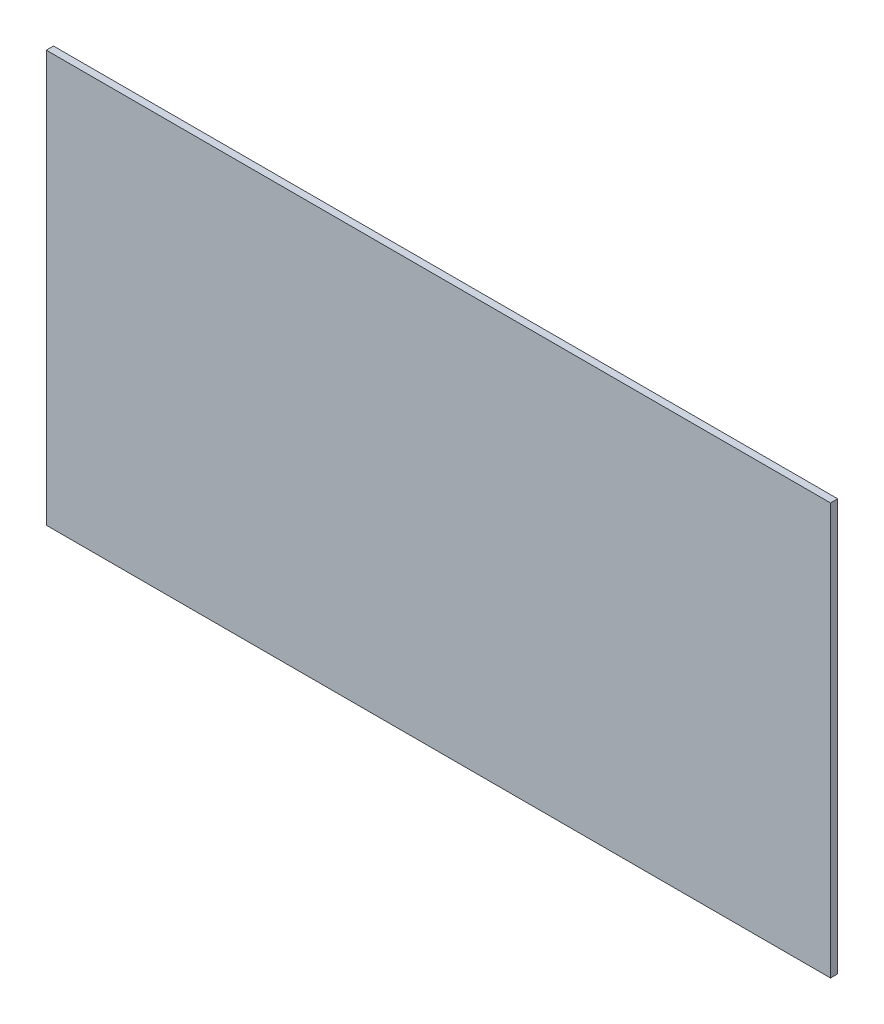
from build123d import *

# Parameters (mm, degrees)
SKETCH1_W           = 346.05
SKETCH1_H           = 181.55
BOSS_EXTRUDE1_DEPTH = 3.175


with BuildPart() as part:
    # Sketch1 → Boss-Extrude1 (new body)
    with BuildSketch(Plane.XY):
        Rectangle(SKETCH1_W, SKETCH1_H)
    extrude(amount=BOSS_EXTRUDE1_DEPTH)


solid = part.part
